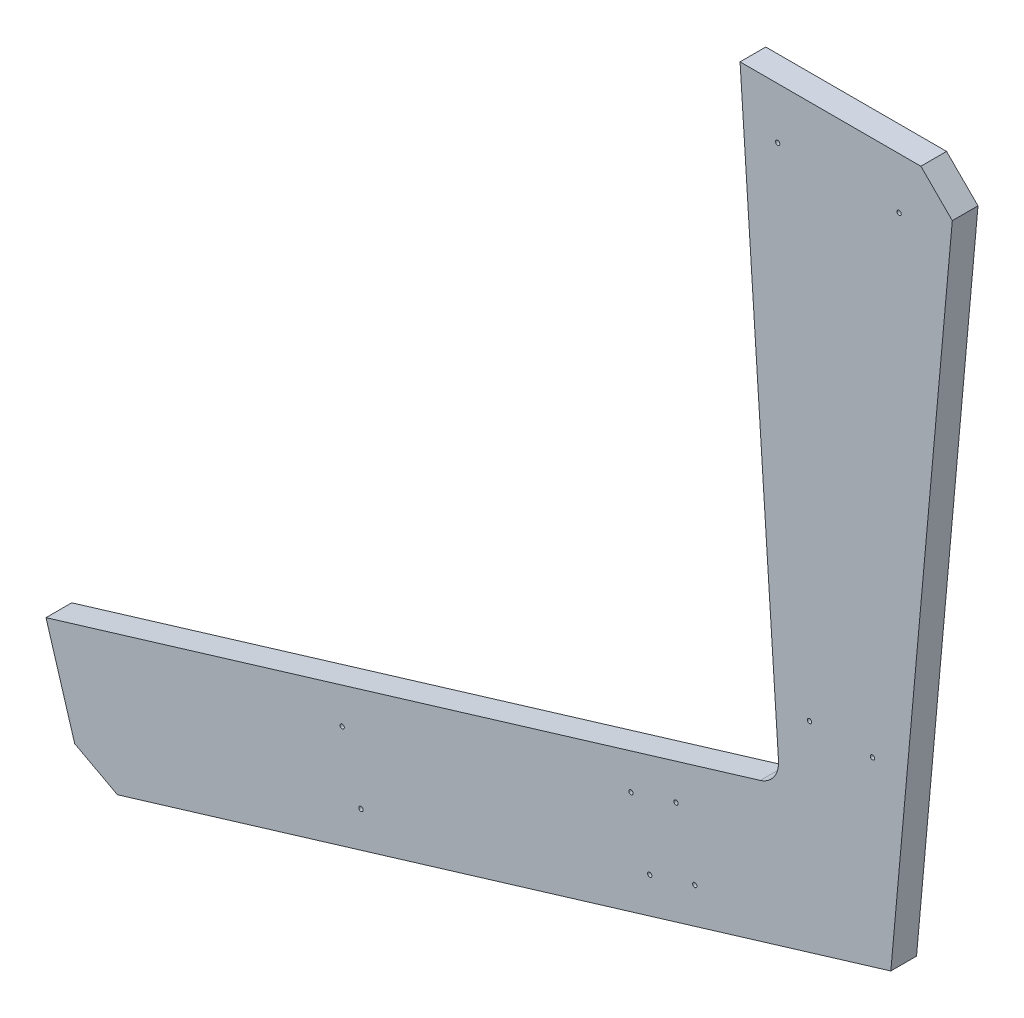
from build123d import *
from OCP.BRepFilletAPI import BRepFilletAPI_MakeChamfer

# Parameters (mm, degrees)
BOSS_EXTRUDE1_DEPTH = 19.05
CHAMFER1_SIZE       = 25.4
CHAMFER1_SIZE2      = 23.3906272
HOLE5_D             = 3.175
HOLE5_DEPTH         = 38.1
HOLE5_CSINK_D       = 10.16
HOLE5_CSINK_ANGLE   = 82
HOLE5_TIP           = 0.953866233
HOLE6_D             = 3.175
HOLE6_DEPTH         = 38.1
HOLE6_CSINK_D       = 10.16
HOLE6_CSINK_ANGLE   = 82
HOLE6_TIP           = 0.953866233


with BuildPart() as part:
    # Sketch1 → Boss-Extrude1 (new body)
    with BuildSketch(Plane.XY):
        with BuildLine():
            Line((-3.953124323, 12.7), (24.552678578, -421.625981048))
            ThreePointArc((24.552678578, -421.625981048), (21.20483187, -433.719216416), (11.061953733, -441.106803461))
            Line((11.061953733, -441.106803461), (-518.461959982, -601.369999539))
            Line((-518.461959982, -601.369999539), (-489.829069295, -695.97562771))
            Line((-489.829069295, -695.97562771), (107.818813597, -515.094354248))
            Line((107.818813597, -515.094354248), (155.492294041, 12.7))
            Line((155.492294041, 12.7), (-3.953124323, 12.7))
        make_face()
    extrude(amount=-BOSS_EXTRUDE1_DEPTH)

    # Chamfer1: one chamfer whose edges measure the first distance from different faces: ONE call of the kernel's chamfer builder (chamfer() names one face for all edges)
    chamfer1_edges_1 = [part.edges().sort_by_distance(p)[0] for p in [
        (-489.829069295, -695.97562771, -9.525),
    ]]
    chamfer1_edges_2 = [part.edges().sort_by_distance(p)[0] for p in [
        (155.492294041, 12.7, -9.525),
    ]]
    chamfer1_side_2 = [part.faces().sort_by_distance(p)[0] for p in [
        (75.769584859, 12.7, -9.525),
    ]]
    chamfer1 = BRepFilletAPI_MakeChamfer(part.part.solid().wrapped)
    for e in chamfer1_edges_1:
        chamfer1.Add(CHAMFER1_SIZE, e.wrapped)
    for e in chamfer1_edges_2:
        chamfer1.Add(CHAMFER1_SIZE, CHAMFER1_SIZE2, e.wrapped, chamfer1_side_2[0].wrapped)  # the first distance lies on this face
    add(Compound.cast(chamfer1.Shape()), mode=Mode.REPLACE)

    # Hole5
    with Locations(Plane(origin=(155.286738577, 10.424290059, -19.05), x_dir=(-0.08995962873759064, -0.9959454127598535, 0), z_dir=(0, 0, -1))):
        with Locations((47.413288654, 127.596711745), (39.315467427, 37.945520226), (403.288916316, 71.764018496), (399.091743996, 25.297013484), (513.561319184, 161.164706775), (558.106616554, 143.167238399), (571.189751829, 175.54913452), (654.969392627, 382.911022042), (526.644454459, 193.546602895), (610.424095257, 400.908490418)):
            CounterSinkHole(HOLE5_D / 2, HOLE5_CSINK_D / 2, depth=HOLE5_DEPTH, counter_sink_angle=HOLE5_CSINK_ANGLE)
            with Locations((0, 0, -(HOLE5_DEPTH + HOLE5_TIP / 2))):  # 118° drill point
                Cone(0, HOLE5_D / 2, HOLE5_TIP, mode=Mode.SUBTRACT)

    # Hole6
    with Locations(Plane(origin=(-643.705760022, -231.394989772, 165.474999994), x_dir=(0, 0, -1), z_dir=(-0.9571239768071421, -0.2896786029738502, -1.2569443472852944e-15))):
        with Locations((-108.649999997, 332.89193461), (108.649999997, 332.89193461), (207.774999994, 332.89193461), (174.999999994, 448.336332751), (135.266666663, 384.042401694), (176.283333328, 384.042401694), (-174.999999994, 448.336332751), (-135.266666663, 384.042401694), (-176.283333328, 384.042401694), (-207.774999994, 332.89193461)):
            CounterSinkHole(HOLE6_D / 2, HOLE6_CSINK_D / 2, depth=HOLE6_DEPTH, counter_sink_angle=HOLE6_CSINK_ANGLE)
            with Locations((0, 0, -(HOLE6_DEPTH + HOLE6_TIP / 2))):  # 118° drill point
                Cone(0, HOLE6_D / 2, HOLE6_TIP, mode=Mode.SUBTRACT)


solid = part.part
